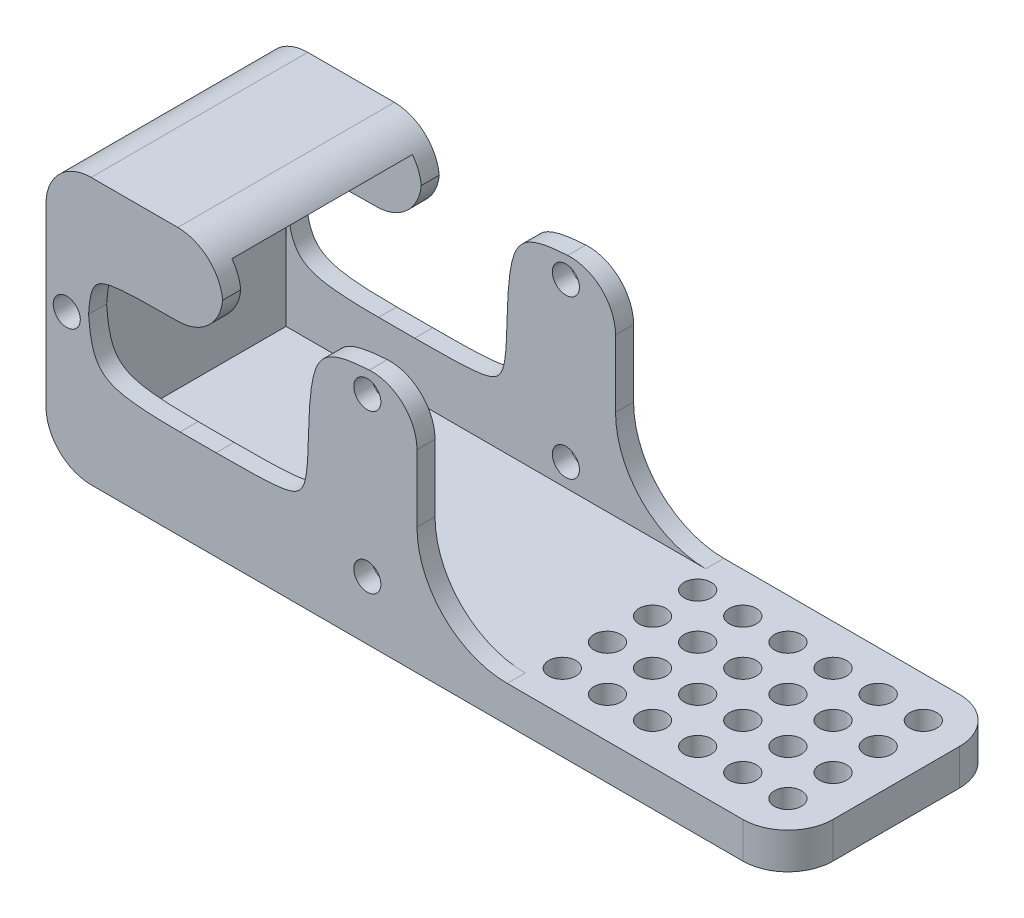
from build123d import *
from build123d.topology import SkipClean

# Parameters (mm, degrees)
BOSS_EXTRU_4_DEPTH      = 2
ESQUISSE5_R             = 1.5
ENL_V_MAT_EXTRU_1_DEPTH = 3
ESQUISSE6_R             = 1.5
ENL_V_MAT_EXTRU_2_DEPTH = 3
ESQUISSE8_W             = 41.1
ESQUISSE8_H             = 2
BOSS_EXTRU_6_DEPTH      = 10
CONG_2_DEPTH            = 2
CONG_3_DEPTH            = 2
CONG_4_START            = -1
CONG_4_DEPTH            = 4
ESQUISSE9_W             = 4.6
ESQUISSE9_H             = 22.5
ESQUISSE9_R             = 1.5
BOSS_EXTRU_7_DEPTH      = 10
ESQUISSE10_W            = 4.6
ESQUISSE10_H            = 8.25
BOSS_EXTRU_8_DEPTH      = 2.5
ESQUISSE11_W            = 4.6
ESQUISSE11_H            = 22.5
ESQUISSE11_R            = 1.5
BOSS_EXTRU_9_DEPTH      = 7.5
ESQUISSE13_W            = 4.6
ESQUISSE13_H            = 2.5
BOSS_EXTRU_10_DEPTH     = 5
ESQUISSE14_W            = 41.1
ESQUISSE14_H            = 24
BOSS_EXTRU_11_DEPTH     = 2
CONG_7_START            = -22
CONG_7_DEPTH            = 2
CONG_7_2_DEPTH          = 2
ESQUISSE15_R            = 1.5
ENL_V_MAT_EXTRU_3_DEPTH = 2
CONG_8_R                = 5
CONG_9_R                = 5
BOSS_EXTRU_12_OUTLINE_R = 1.5
BOSS_EXTRU_12_DEPTH     = 2
ESQUISSE18_W            = 2
ESQUISSE18_H            = 6
BOSS_EXTRU_13_DEPTH     = 15
BOSS_EXTRU_14_DEPTH     = 3
ESQUISSE20_W            = 20
ESQUISSE20_H            = 2
BOSS_EXTRU_15_DEPTH     = 15
CONG_10_SIZE            = 10
CONG_11_R               = 5
CONG_12_R               = 5


with BuildPart() as part:
    # Esquisse4 → Boss.-Extru.4 (new body)
    with BuildSketch(Plane.XY):
        Polygon((0, 0), (0, 24.5), (4.6, 24.5), (4.6, 8), (29.1, 8), (29.1, 24.5), (41.1, 24.5), (41.1, 0), align=None)
    extrude(amount=BOSS_EXTRU_4_DEPTH)

    # Esquisse5 → Enlèv. mat.-Extru.1 (cut)
    with BuildSketch(Plane.XY.offset(2)):
        with Locations((35.6, 22)):
            Circle(ESQUISSE5_R)
        with Locations((35.6, 4.5)):
            Circle(ESQUISSE5_R)
    extrude(amount=-ENL_V_MAT_EXTRU_1_DEPTH, mode=Mode.SUBTRACT)

    # Esquisse6 → Enlèv. mat.-Extru.2 (cut)
    with BuildSketch(Plane.XY.offset(2)):
        with Locations((2.3, 13.25)):
            Circle(ESQUISSE6_R)
    extrude(amount=-ENL_V_MAT_EXTRU_2_DEPTH, mode=Mode.SUBTRACT)

    # Esquisse8 → Boss.-Extru.6 (add)
    with BuildSketch(Plane(origin=(0, 0, 0), x_dir=(-1, 0, 0), z_dir=(0, 0, -1))):
        with Locations((-20.55, 1)):
            Rectangle(ESQUISSE8_W, ESQUISSE8_H)
    extrude(amount=BOSS_EXTRU_6_DEPTH)

    # Congé2: read off the stored shape, not the designer's step
    # Congé2 outline → Congé2 (add)
    with BuildSketch(Plane.XY):
        with BuildLine():
            Line((29.1, 8), (29.1, 18.25))
            add(Edge.make_bspline(
                [(29.1, 18.25), (29.1, 8), (18.85, 8)],
                knots=[0, 0, 0, 1, 1, 1], degree=2, weights=[1, 4, 1]))
            Line((18.85, 8), (29.1, 8))
        make_face()
    extrude(amount=CONG_2_DEPTH)

    # Congé3: read off the stored shape, not the designer's step
    # Congé3 outline → Congé3 (add)
    with BuildSketch(Plane.XY):
        with BuildLine():
            Line((4.6, 8), (14.85, 8))
            add(Edge.make_bspline(
                [(14.85, 8), (4.6, 8), (4.6, 18.25)],
                knots=[0, 0, 0, 1, 1, 1], degree=2, weights=[1, 2.333333333, 1]))
            Line((4.6, 18.25), (4.6, 8))
        make_face()
    extrude(amount=CONG_3_DEPTH)

    # Congé4: read off the stored shape, not the designer's step
    # Congé4 outline → Congé4 (cut)
    with BuildSketch(Plane.XY.offset(CONG_4_START)):
        with BuildLine():
            add(Edge.make_bspline(
                [(29.1, 18.25), (29.1, 15.958664534), (29.066412953, 14.483281118)],
                knots=[0, 0, 0, 0.067143407, 0.067143407, 0.067143407], degree=2, weights=[1, 1.20143022, 1.375811018]))
            add(Edge.make_bspline(
                [(29.066412953, 14.483281118), (29.294443249, 24.5), (39.313757971, 24.5)],
                knots=[0, 0, 0, 1, 1, 1], degree=2, weights=[1, 2.333333333, 1]))
            Line((39.313757971, 24.5), (29.1, 24.5))
            Line((29.1, 24.5), (29.1, 18.25))
        make_face()
    extrude(amount=CONG_4_DEPTH, mode=Mode.SUBTRACT)

    # Symétrie14: part across plane


with BuildPart() as part_1:
    add(part.part)
    add(part.part.mirror(Plane(origin=(0, 0, -10), x_dir=(1, 0, 0), z_dir=(0, 0, -1))))

    # Esquisse9 → Boss.-Extru.7 (add)
    with BuildSketch(Plane.XY.offset(-20)):
        with Locations((2.3, 13.25)):
            Rectangle(ESQUISSE9_W, ESQUISSE9_H)
        with Locations((2.3, 13.25)):
            Circle(ESQUISSE9_R, mode=Mode.SUBTRACT)
    extrude(amount=BOSS_EXTRU_7_DEPTH)

    # Esquisse10 → Boss.-Extru.8 (add)
    with BuildSketch(Plane.XY.offset(-10)):
        with Locations((2.3, 6.125)):
            Rectangle(ESQUISSE10_W, ESQUISSE10_H)
    extrude(amount=BOSS_EXTRU_8_DEPTH)

    # Esquisse11 → Boss.-Extru.9 (add)
    with BuildSketch(Plane(origin=(0, 0, 0), x_dir=(-1, 0, 0), z_dir=(0, 0, -1))):
        with Locations((-2.3, 13.25)):
            Rectangle(ESQUISSE11_W, ESQUISSE11_H)
        with Locations(Location((-2.3, 13.25, 0), (0, 0, 180))):
            Circle(ESQUISSE11_R, mode=Mode.SUBTRACT)
    extrude(amount=BOSS_EXTRU_9_DEPTH)

    # Esquisse13 → Boss.-Extru.10 (add)
    with BuildSketch(Plane(origin=(0, 24.5, 0), x_dir=(1, 0, 0), z_dir=(0, 1, 0))):
        with Locations((2.3, 8.75)):
            Rectangle(ESQUISSE13_W, ESQUISSE13_H)
    extrude(amount=-BOSS_EXTRU_10_DEPTH)

    # Esquisse14 → Boss.-Extru.11 (add)
    with BuildSketch(Plane.XZ):
        with Locations((61.65, -10)):
            Rectangle(ESQUISSE14_W, ESQUISSE14_H)
    extrude(amount=-BOSS_EXTRU_11_DEPTH)

    # Congé7: read off the stored shape, not the designer's step
    # Congé7 outline → Congé7 (add)
    with SkipClean():  # the faces are left unmerged after this step: merging them gives an invalid solid
        with BuildSketch(Plane.XY.offset(CONG_7_START)):
            with BuildLine():
                ThreePointArc((51.1, 2), (44.028932188, 4.928932188), (41.1, 12))
                Line((41.1, 12), (41.1, 2))
                Line((41.1, 2), (51.1, 2))
            make_face()
        extrude(amount=CONG_7_DEPTH)

    # Cong_7 2 outline → Cong_7 2 (add)
    with BuildSketch(Plane.XY):
        with BuildLine():
            ThreePointArc((51.1, 2), (44.028932188, 4.928932188), (41.1, 12))
            Line((41.1, 12), (41.1, 2))
            Line((41.1, 2), (51.1, 2))
        make_face()
    extrude(amount=CONG_7_2_DEPTH)

    # Esquisse15 → Enlèv. mat.-Extru.3 (cut)
    with BuildSketch(Plane(origin=(0, 2, 0), x_dir=(1, 0, 0), z_dir=(0, 1, 0))):
        with Locations(Location((77.7, 17.5, 0), (0, 0, 270))):
            Circle(ESQUISSE15_R)
        with Locations(Location((72.7, 17.5, 0), (0, 0, 270))):
            Circle(ESQUISSE15_R)
        with Locations(Location((67.7, 17.5, 0), (0, 0, 270))):
            Circle(ESQUISSE15_R)
        with Locations(Location((62.7, 17.5, 0), (0, 0, 270))):
            Circle(ESQUISSE15_R)
        with Locations(Location((57.7, 17.5, 0), (0, 0, 270))):
            Circle(ESQUISSE15_R)
        with Locations(Location((52.7, 17.5, 0), (0, 0, 270))):
            Circle(ESQUISSE15_R)
        with Locations(Location((72.7, 12.5, 0), (0, 0, 270))):
            Circle(ESQUISSE15_R)
        with Locations(Location((67.7, 12.5, 0), (0, 0, 270))):
            Circle(ESQUISSE15_R)
        with Locations(Location((62.7, 12.5, 0), (0, 0, 270))):
            Circle(ESQUISSE15_R)
        with Locations(Location((57.7, 12.5, 0), (0, 0, 270))):
            Circle(ESQUISSE15_R)
        with Locations(Location((52.7, 12.5, 0), (0, 0, 270))):
            Circle(ESQUISSE15_R)
        with Locations(Location((72.7, 7.5, 0), (0, 0, 270))):
            Circle(ESQUISSE15_R)
        with Locations(Location((67.7, 7.5, 0), (0, 0, 270))):
            Circle(ESQUISSE15_R)
        with Locations(Location((62.7, 7.5, 0), (0, 0, 270))):
            Circle(ESQUISSE15_R)
        with Locations(Location((57.7, 7.5, 0), (0, 0, 270))):
            Circle(ESQUISSE15_R)
        with Locations(Location((52.7, 7.5, 0), (0, 0, 270))):
            Circle(ESQUISSE15_R)
        with Locations(Location((72.7, 2.5, 0), (0, 0, 270))):
            Circle(ESQUISSE15_R)
        with Locations(Location((67.7, 2.5, 0), (0, 0, 270))):
            Circle(ESQUISSE15_R)
        with Locations(Location((62.7, 2.5, 0), (0, 0, 270))):
            Circle(ESQUISSE15_R)
        with Locations(Location((57.7, 2.5, 0), (0, 0, 270))):
            Circle(ESQUISSE15_R)
        with Locations(Location((52.7, 2.5, 0), (0, 0, 270))):
            Circle(ESQUISSE15_R)
        with Locations(Location((77.7, 12.5, 0), (0, 0, 270))):
            Circle(ESQUISSE15_R)
        with Locations(Location((77.7, 7.5, 0), (0, 0, 270))):
            Circle(ESQUISSE15_R)
        with Locations(Location((77.7, 2.5, 0), (0, 0, 270))):
            Circle(ESQUISSE15_R)
    extrude(amount=-ENL_V_MAT_EXTRU_3_DEPTH, mode=Mode.SUBTRACT)

    # Congé8
    # the kernel refuses this fillet: 5 mm, written as the material it takes off along each edge
    with BuildSketch(Plane(origin=(41.1, 24.5, -13.224262805), x_dir=(-0.999878938134432, -0.015559854599604569, 0), z_dir=(0, 0, 1))) as cong_8_piece_1:
        with BuildLine():
            CenterArc((5.078344525, 4.995530672), CONG_8_R, 179.108450024, 93.314285921)
            Line((0.078949834, 5.073329945), (-0.420989635, 5.081109873))
            Line((-0.420989635, 5.081109873), (-0.499939469, 0.007779927))
            Line((-0.499939469, 0.007779927), (-0.007779927, -0.499939469))
            ThreePointArc((-0.007779927, -0.499939469), (1.778245856, -0.527733135), (5.310841182, -0.499553067))
            Line((5.310841182, -0.499553067), (5.289705122, 0))
        make_face()
    extrude(amount=28.44852561, mode=Mode.SUBTRACT)
    with BuildSketch(Plane(origin=(41.1, 24.5, -6.775737195), x_dir=(-0.999878938134432, -0.015559854599604569, 0), z_dir=(0, 0, -1))) as cong_8_piece_2:
        with BuildLine():
            CenterArc((5.078344525, -4.995530672), CONG_8_R, 87.577264055, 93.314285921)
            Line((0.078949834, -5.073329945), (-0.420989635, -5.081109873))
            Line((-0.420989635, -5.081109873), (-0.499939469, -0.007779927))
            Line((-0.499939469, -0.007779927), (-0.007779927, 0.499939469))
            ThreePointArc((-0.007779927, 0.499939469), (1.778245856, 0.527733135), (5.310841182, 0.499553067))
            Line((5.310841182, 0.499553067), (5.289705122, 0))
        make_face()
    extrude(amount=28.44852561, mode=Mode.SUBTRACT)

    # Congé9
    cong_9_edges = [part_1.edges().sort_by_distance(p)[0] for p in [
        (82.2, 1, 2),
        (82.2, 1, -22),
    ]]
    fillet(cong_9_edges, radius=CONG_9_R)

    # Boss.-Extru.12: read off the stored shape, not the designer's step
    # Boss.-Extru.12 outline → Boss.-Extru.12 (add)
    with SkipClean():  # the faces are left unmerged after this step: merging them gives an invalid solid
        with BuildSketch(Plane.XZ):
            with BuildLine():
                Line((77.2, 2), (0, 2))
                Line((0, 2), (0, -22))
                Line((0, -22), (77.2, -22))
                ThreePointArc((77.2, -22), (80.735533906, -20.535533906), (82.2, -17))
                Line((82.2, -17), (82.2, -3))
                ThreePointArc((82.2, -3), (80.735533906, 0.535533906), (77.2, 2))
            make_face()
            with Locations((52.7, -17.5)):
                Circle(BOSS_EXTRU_12_OUTLINE_R, mode=Mode.SUBTRACT)
            with Locations((57.7, -17.5)):
                Circle(BOSS_EXTRU_12_OUTLINE_R, mode=Mode.SUBTRACT)
            with Locations((62.7, -17.5)):
                Circle(BOSS_EXTRU_12_OUTLINE_R, mode=Mode.SUBTRACT)
            with Locations((67.7, -17.5)):
                Circle(BOSS_EXTRU_12_OUTLINE_R, mode=Mode.SUBTRACT)
            with Locations((72.7, -17.5)):
                Circle(BOSS_EXTRU_12_OUTLINE_R, mode=Mode.SUBTRACT)
            with Locations((77.7, -17.5)):
                Circle(BOSS_EXTRU_12_OUTLINE_R, mode=Mode.SUBTRACT)
            with Locations((52.7, -12.5)):
                Circle(BOSS_EXTRU_12_OUTLINE_R, mode=Mode.SUBTRACT)
            with Locations((57.7, -12.5)):
                Circle(BOSS_EXTRU_12_OUTLINE_R, mode=Mode.SUBTRACT)
            with Locations((62.7, -12.5)):
                Circle(BOSS_EXTRU_12_OUTLINE_R, mode=Mode.SUBTRACT)
            with Locations((67.7, -12.5)):
                Circle(BOSS_EXTRU_12_OUTLINE_R, mode=Mode.SUBTRACT)
            with Locations((72.7, -12.5)):
                Circle(BOSS_EXTRU_12_OUTLINE_R, mode=Mode.SUBTRACT)
            with Locations((77.7, -12.5)):
                Circle(BOSS_EXTRU_12_OUTLINE_R, mode=Mode.SUBTRACT)
            with Locations((52.7, -7.5)):
                Circle(BOSS_EXTRU_12_OUTLINE_R, mode=Mode.SUBTRACT)
            with Locations((57.7, -7.5)):
                Circle(BOSS_EXTRU_12_OUTLINE_R, mode=Mode.SUBTRACT)
            with Locations((62.7, -7.5)):
                Circle(BOSS_EXTRU_12_OUTLINE_R, mode=Mode.SUBTRACT)
            with Locations((67.7, -7.5)):
                Circle(BOSS_EXTRU_12_OUTLINE_R, mode=Mode.SUBTRACT)
            with Locations((72.7, -7.5)):
                Circle(BOSS_EXTRU_12_OUTLINE_R, mode=Mode.SUBTRACT)
            with Locations((77.7, -7.5)):
                Circle(BOSS_EXTRU_12_OUTLINE_R, mode=Mode.SUBTRACT)
            with Locations((52.7, -2.5)):
                Circle(BOSS_EXTRU_12_OUTLINE_R, mode=Mode.SUBTRACT)
            with Locations((57.7, -2.5)):
                Circle(BOSS_EXTRU_12_OUTLINE_R, mode=Mode.SUBTRACT)
            with Locations((62.7, -2.5)):
                Circle(BOSS_EXTRU_12_OUTLINE_R, mode=Mode.SUBTRACT)
            with Locations((67.7, -2.5)):
                Circle(BOSS_EXTRU_12_OUTLINE_R, mode=Mode.SUBTRACT)
            with Locations((72.7, -2.5)):
                Circle(BOSS_EXTRU_12_OUTLINE_R, mode=Mode.SUBTRACT)
            with Locations((77.7, -2.5)):
                Circle(BOSS_EXTRU_12_OUTLINE_R, mode=Mode.SUBTRACT)
        extrude(amount=BOSS_EXTRU_12_DEPTH)
    add(part_1.part.scale(1), mode=Mode.REPLACE)  # the faces are merged on a copy

    # Esquisse18 → Boss.-Extru.13 (add)
    with BuildSketch(Plane(origin=(4.6, 0, 0), x_dir=(0, 0, -1), z_dir=(1, 0, 0))):
        with Locations((-1, 21.5)):
            Rectangle(ESQUISSE18_W, ESQUISSE18_H)
        with Locations((21, 21.5)):
            Rectangle(ESQUISSE18_W, ESQUISSE18_H)
    extrude(amount=BOSS_EXTRU_13_DEPTH)

    # Esquisse19 → Boss.-Extru.14 (add)
    with BuildSketch(Plane(origin=(0, 24.5, 0), x_dir=(1, 0, 0), z_dir=(0, 1, 0))):
        Polygon((0, -2), (19.6, -2), (19.6, 0), (4.6, 0), (4.6, 20), (19.6, 20), (19.6, 22), (0, 22), align=None)
    extrude(amount=BOSS_EXTRU_14_DEPTH)

    # Esquisse20 → Boss.-Extru.15 (add)
    with BuildSketch(Plane(origin=(4.6, 0, 0), x_dir=(0, 0, -1), z_dir=(1, 0, 0))):
        with Locations((10, 26.5)):
            Rectangle(ESQUISSE20_W, ESQUISSE20_H)
    extrude(amount=BOSS_EXTRU_15_DEPTH)

    # Congé10
    # a fillet whose section is not a circle: 10 mm, written as the material it adds along each edge
    with BuildSketch(Plane(origin=(4.6, 18.5, 0), x_dir=(0, -1, 0), z_dir=(0, 0, 1)), Plane(origin=(4.6, 18.5, -20), x_dir=(1, 0, 0), z_dir=(0, 0, -1))) as cong_10_piece_1:
        with BuildLine():
            Bezier((CONG_10_SIZE, 0), (0, 0), (0, CONG_10_SIZE), weights=[1, 4, 1])
            Line((0, CONG_10_SIZE), (-CONG_10_SIZE * 0.02, CONG_10_SIZE))
            Line((-CONG_10_SIZE * 0.02, CONG_10_SIZE), (-CONG_10_SIZE * 0.02, -CONG_10_SIZE * 0.02))
            Line((-CONG_10_SIZE * 0.02, -CONG_10_SIZE * 0.02), (CONG_10_SIZE, -CONG_10_SIZE * 0.02))
            Line((CONG_10_SIZE, -CONG_10_SIZE * 0.02), (CONG_10_SIZE, 0))
        make_face()
    extrude(amount=2)

    # Congé11
    # the kernel refuses this fillet: 5 mm, written as the material it takes off along each edge
    with BuildSketch(Plane(origin=(19.6, 27.5, 14.5), x_dir=(0, -1, 0), z_dir=(0, 0, -1))) as cong_11_piece_1:
        with BuildLine():
            CenterArc((CONG_11_R, CONG_11_R), CONG_11_R, 180, 90)
            Line((0, CONG_11_R), (0, 0))
            Line((0, 0), (CONG_11_R, 0))
        make_face()
    extrude(amount=49, mode=Mode.SUBTRACT)
    with BuildSketch(Plane(origin=(19.6, 18.5, -12.5), x_dir=(-1, 0, 0), z_dir=(0, 0, 1)), Plane(origin=(19.6, 18.5, -7.5), x_dir=(0, 1, 0), z_dir=(0, 0, -1))) as cong_11_piece_2:
        with BuildLine():
            CenterArc((CONG_11_R, -CONG_11_R), CONG_11_R, 90, 90)
            Line((0, -CONG_11_R), (0, 0))
            Line((0, 0), (CONG_11_R, 0))
        make_face()
    extrude(amount=27, mode=Mode.SUBTRACT)

    # Congé12
    cong_12_edges = [part_1.edges().sort_by_distance(p)[0] for p in [
        (0, -2, -10),
        (0, 27.5, -10),
    ]]
    fillet(cong_12_edges, radius=CONG_12_R)


solid = part_1.part
